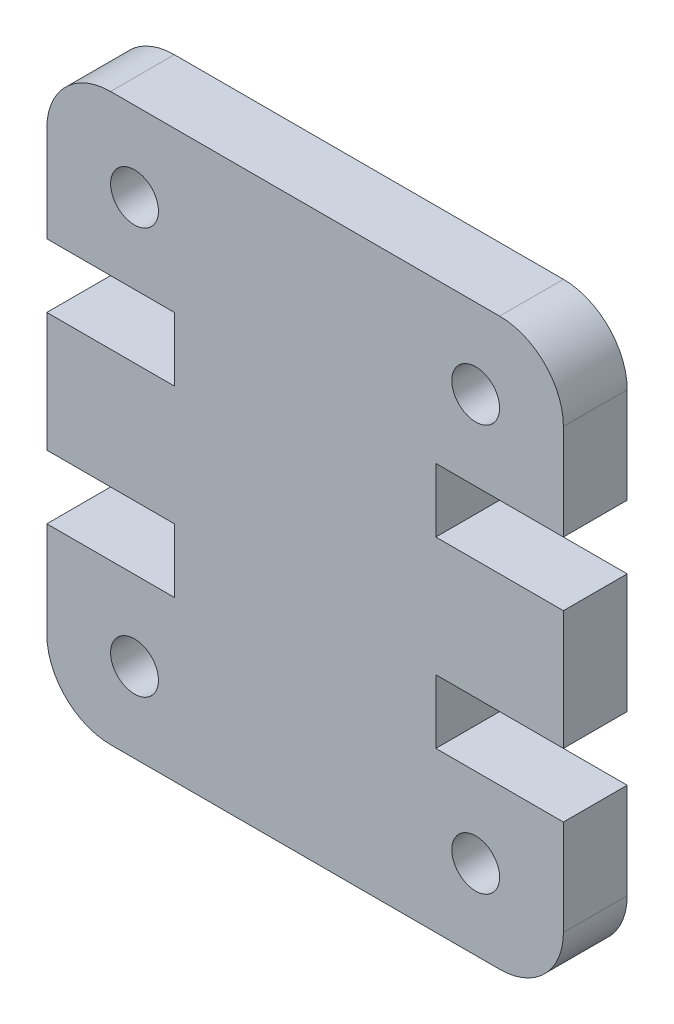
from build123d import *

# Parameters (mm, degrees)
SKETCH1_R           = 0.75
BOSS_EXTRUDE1_DEPTH = 2


with BuildPart() as part:
    # Sketch1 → Boss-Extrude1 (new body)
    with BuildSketch(Plane.XY):
        with BuildLine():
            Line((0, 10.74), (0, 7))
            Line((0, 7), (4, 7))
            Line((4, 7), (4, 5))
            Line((4, 5), (0, 5))
            Line((0, 5), (0, 2))
            ThreePointArc((0, 2), (0.585786438, 0.585786438), (2, 0))
            Line((2, 0), (14.2, 0))
            ThreePointArc((14.2, 0), (15.614213562, 0.585786438), (16.2, 2))
            Line((16.2, 2), (16.2, 5))
            Line((16.2, 5), (12.2, 5))
            Line((12.2, 5), (12.2, 7))
            Line((12.2, 7), (16.2, 7))
            Line((16.2, 7), (16.2, 10.74))
            Line((16.2, 10.74), (12.2, 10.74))
            Line((12.2, 10.74), (12.2, 12.74))
            Line((12.2, 12.74), (16.2, 12.74))
            Line((16.2, 12.74), (16.2, 15.74))
            ThreePointArc((16.2, 15.74), (15.614213562, 17.154213562), (14.2, 17.74))
            Line((14.2, 17.74), (2, 17.74))
            ThreePointArc((2, 17.74), (0.585786438, 17.154213562), (0, 15.74))
            Line((0, 15.74), (0, 12.74))
            Line((0, 12.74), (4, 12.74))
            Line((4, 12.74), (4, 10.74))
            Line((4, 10.74), (0, 10.74))
        make_face()
        with Locations((13.45, 2.5)):
            Circle(SKETCH1_R, mode=Mode.SUBTRACT)
        with Locations((2.75, 2.5)):
            Circle(SKETCH1_R, mode=Mode.SUBTRACT)
        with Locations((13.45, 15.24)):
            Circle(SKETCH1_R, mode=Mode.SUBTRACT)
        with Locations((2.75, 15.24)):
            Circle(SKETCH1_R, mode=Mode.SUBTRACT)
    extrude(amount=BOSS_EXTRUDE1_DEPTH)


solid = part.part
